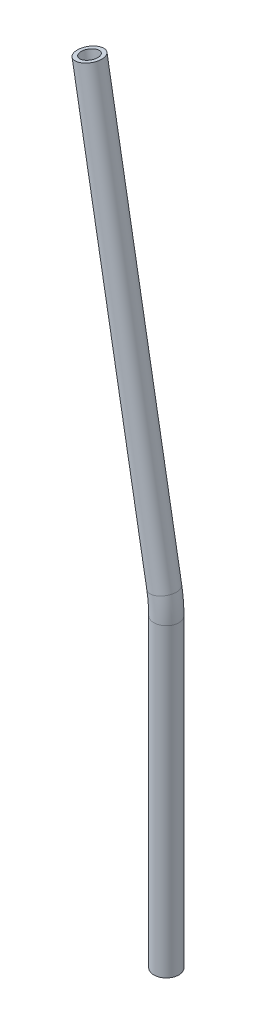
from build123d import *

# Parameters (mm, degrees)
SKETCH1_R   = 0.23622
SKETCH1_R_2 = 0.16002


with BuildPart() as part:
    # Sweep1: sweep along a path in Sketch3
    with BuildLine(Plane.XY) as sweep1_path:
        Line((0, 0), (3e-17, 5.777778794644142))
        ThreePointArc((3e-17, 5.777778794644142), (-0.00966546684696645, 5.999154381223206), (-0.03858830734899395, 6.218845165918169))
        Line((-0.03858830734899395, 6.218845165918169), (-1.4550974859604127, 14.252267917898632))
    # Sketch1 → Sweep1 (sweep)
    with BuildSketch(Plane(origin=(0, 0, 0), x_dir=(1, 0, 0), z_dir=(0, 1, 0))):
        Circle(SKETCH1_R)
        Circle(SKETCH1_R_2, mode=Mode.SUBTRACT)
    sweep(path=sweep1_path.line)


solid = part.part
